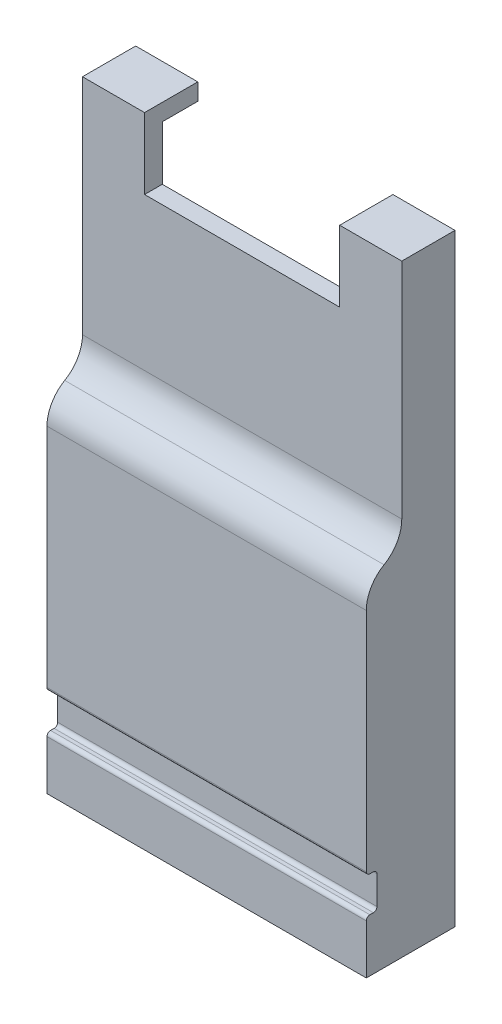
from build123d import *

# Parameters (mm, degrees)
SKETCH_1_W          = 90
SKETCH_1_H          = 170
EXTRUDE_1_DEPTH     = 25
SKETCH_2_W          = 90
SKETCH_2_H          = 70.292308138
CUT_EXTRUDE_1_DEPTH = 10
FILLET_1_R          = 10
FILLET_2_R          = 10
SKETCH_3_W          = 80.5
SKETCH_3_H          = 165.25
CUT_EXTRUDE_2_DEPTH = 10
SKETCH_5_W          = 0.6
SKETCH_5_H          = 165.25
EXTRUDE_2_DEPTH     = 0.9
SKETCH_6_W          = 0.6
SKETCH_6_H          = 165.25
EXTRUDE_3_DEPTH     = 0.9
SKETCH_9_W          = 90
SKETCH_9_H          = 10
CUT_EXTRUDE_5_DEPTH = 3
FILLET_8_R          = 1
FILLET_9_R          = 1
SKETCH_10_W         = 55
SKETCH_10_H         = 40
CUT_EXTRUDE_6_DEPTH = 20


with BuildPart() as part:
    # 草图1 → 凸台-拉伸1 (new body)
    with BuildSketch(Plane.XY):
        Rectangle(SKETCH_1_W, SKETCH_1_H)
    extrude(amount=EXTRUDE_1_DEPTH)

    # 草图2 → 切除-拉伸1 (cut)
    with BuildSketch(Plane.XY.offset(25)):
        with Locations((0, 49.853845931)):
            Rectangle(SKETCH_2_W, SKETCH_2_H)
    extrude(amount=-CUT_EXTRUDE_1_DEPTH, mode=Mode.SUBTRACT)

    # 圆角1
    fillet_1_edges = [part.edges().sort_by_distance(p)[0] for p in [
        (0, 14.707691862, 25),
    ]]
    fillet(fillet_1_edges, radius=FILLET_1_R - 0.0001)  # a hair under: the kernel refuses the full size

    # 圆角2
    fillet_2_edges = [part.edges().sort_by_distance(p)[0] for p in [
        (0, 14.707691862, 15),
    ]]
    fillet(fillet_2_edges, radius=FILLET_2_R)

    # 草图3 → 切除-拉伸2 (cut)
    with BuildSketch(Plane(origin=(0, 0, 0), x_dir=(-1, 0, 0), z_dir=(0, 0, -1))):
        with Locations((0, -2.375)):
            Rectangle(SKETCH_3_W, SKETCH_3_H)
    extrude(amount=-CUT_EXTRUDE_2_DEPTH, mode=Mode.SUBTRACT)

    # 草图5 → 凸台-拉伸2 (add)
    with BuildSketch(Plane.ZY.offset(-40.25)):
        with Locations((8.5, -2.375)):
            Rectangle(SKETCH_5_W, SKETCH_5_H)
    extrude(amount=EXTRUDE_2_DEPTH)

    # 草图6 → 凸台-拉伸3 (add)
    with BuildSketch(Plane(origin=(-40.25, 0, 0), x_dir=(0, 0, -1), z_dir=(1, 0, 0))):
        with Locations((-9.1, -2.375)):
            Rectangle(SKETCH_6_W, SKETCH_6_H)
    extrude(amount=EXTRUDE_3_DEPTH)

    # 草图9 → 切除-拉伸5 (cut)
    with BuildSketch(Plane.XY.offset(25)):
        with Locations((0, -65.064201391)):
            Rectangle(SKETCH_9_W, SKETCH_9_H)
    extrude(amount=-CUT_EXTRUDE_5_DEPTH, mode=Mode.SUBTRACT)

    # 圆角8
    fillet_8_edges = [part.edges().sort_by_distance(p)[0] for p in [
        (0, -60.064201391, 22),
        (0, -60.064201391, 25),
    ]]
    fillet(fillet_8_edges, radius=FILLET_8_R)

    # 圆角9
    fillet_9_edges = [part.edges().sort_by_distance(p)[0] for p in [
        (0, -70.064201391, 22),
        (0, -70.064201391, 25),
    ]]
    fillet(fillet_9_edges, radius=FILLET_9_R)

    # 草图10 → 切除-拉伸6 (cut)
    with BuildSketch(Plane.XY.offset(15)):
        with Locations((0, 85)):
            Rectangle(SKETCH_10_W, SKETCH_10_H)
    extrude(amount=-CUT_EXTRUDE_6_DEPTH, mode=Mode.SUBTRACT)


solid = part.part
